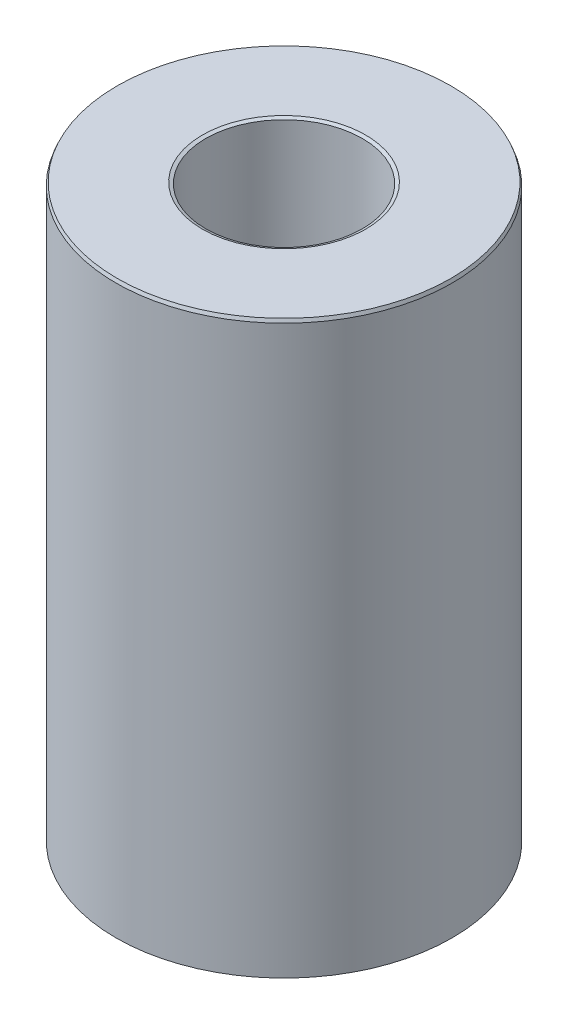
from build123d import *
from OCP.BRepFilletAPI import BRepFilletAPI_MakeChamfer

# Parameters (mm, degrees)
SKETCH1_R           = 55
BOSS_EXTRUDE1_DEPTH = 187.021288903
SKETCH2_R           = 25.611317992
CUT_EXTRUDE1_DEPTH  = 203.551135527
CHAMFER1_SIZE       = 1.087422531
CHAMFER1_SIZE2      = 0.429422029


with BuildPart() as part:
    # Sketch1 → Boss-Extrude1 (new body)
    with BuildSketch(Plane(origin=(0, 0, 0), x_dir=(1, 0, 0), z_dir=(0, 1, 0))):
        Circle(SKETCH1_R)
    extrude(amount=BOSS_EXTRUDE1_DEPTH)

    # Sketch2 → Cut-Extrude1 (cut, through all)
    with BuildSketch(Plane(origin=(0, 0, 0), x_dir=(1, 0, 0), z_dir=(0, 1, 0))):
        Circle(SKETCH2_R)
    extrude(amount=CUT_EXTRUDE1_DEPTH, mode=Mode.SUBTRACT)

    # Chamfer1: one chamfer whose edges measure the first distance from different faces: ONE call of the kernel's chamfer builder (chamfer() names one face for all edges)
    chamfer1_edges_1 = [part.edges().sort_by_distance(p)[0] for p in [
        (-25.611317992, 187.021288903, 0),
    ]]
    chamfer1_side_1 = [part.faces().sort_by_distance(p)[0] for p in [
        (-53.444365081, 187.021288903, 0),
    ]]
    chamfer1_edges_2 = [part.edges().sort_by_distance(p)[0] for p in [
        (-25.611317992, 0, 0),
    ]]
    chamfer1_side_2 = [part.faces().sort_by_distance(p)[0] for p in [
        (-25.611317992, 93.510644452, 0),
    ]]
    chamfer1_edges_3 = [part.edges().sort_by_distance(p)[0] for p in [
        (-55, 0, 0),
    ]]
    chamfer1_side_3 = [part.faces().sort_by_distance(p)[0] for p in [
        (-53.444365081, 0, 0),
    ]]
    chamfer1_edges_4 = [part.edges().sort_by_distance(p)[0] for p in [
        (-55, 187.021288903, 0),
    ]]
    chamfer1_side_4 = [part.faces().sort_by_distance(p)[0] for p in [
        (-55, 93.510644452, 0),
    ]]
    chamfer1 = BRepFilletAPI_MakeChamfer(part.part.solid().wrapped)
    for e in chamfer1_edges_1:
        chamfer1.Add(CHAMFER1_SIZE, CHAMFER1_SIZE2, e.wrapped, chamfer1_side_1[0].wrapped)  # the first distance lies on this face
    for e in chamfer1_edges_2:
        chamfer1.Add(CHAMFER1_SIZE, CHAMFER1_SIZE2, e.wrapped, chamfer1_side_2[0].wrapped)  # the first distance lies on this face
    for e in chamfer1_edges_3:
        chamfer1.Add(CHAMFER1_SIZE, CHAMFER1_SIZE2, e.wrapped, chamfer1_side_3[0].wrapped)  # the first distance lies on this face
    for e in chamfer1_edges_4:
        chamfer1.Add(CHAMFER1_SIZE, CHAMFER1_SIZE2, e.wrapped, chamfer1_side_4[0].wrapped)  # the first distance lies on this face
    add(Compound.cast(chamfer1.Shape()), mode=Mode.REPLACE)


solid = part.part
